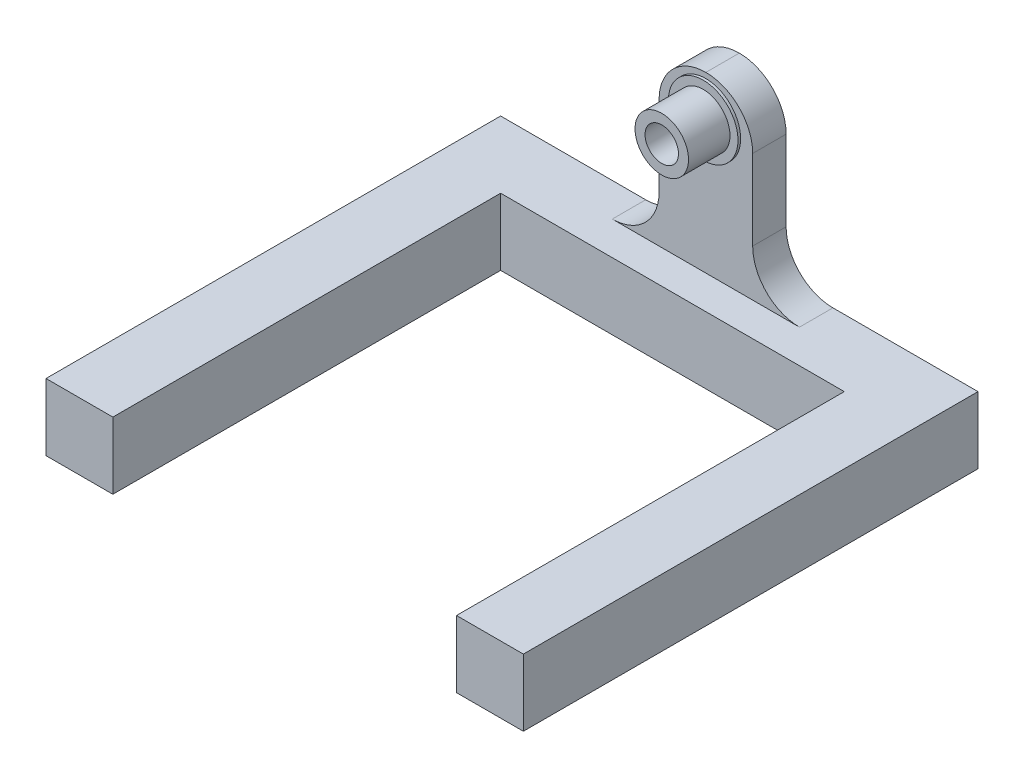
from build123d import *

# Parameters (mm, degrees)
SKETCH2_W           = 71.4
SKETCH2_H           = 93
SKETCH2_W_2         = 51.4
SKETCH2_H_2         = 73
BOSS_EXTRUDE1_DEPTH = 10
SKETCH3_W           = 14
SKETCH3_H           = 26
SKETCH3_R           = 2.5
BOSS_EXTRUDE2_DEPTH = 5
SKETCH4_R           = 4
SKETCH4_R_2         = 2.5
BOSS_EXTRUDE3_DEPTH = 6.6
SKETCH5_W           = 51.4
SKETCH5_H           = 10
CUT_EXTRUDE1_DEPTH  = 65.130647899
SKETCH6_R           = 5.2
SKETCH6_R_2         = 4
BOSS_EXTRUDE4_DEPTH = 0.4
SKETCH7_W           = 71.4
SKETCH7_H           = 25
CUT_EXTRUDE2_DEPTH  = 65.130647899
BOSS_EXTRUDE5_START = 0.4
SKETCH8_R           = 2.9
SKETCH8_R_2         = 2.5
BOSS_EXTRUDE5_DEPTH = 0.4
FILLET1_START       = -46.5
FILLET1_DEPTH       = 5
FILLET1_2_DEPTH     = 5


with BuildPart() as part:
    # Sketch2 → Boss-Extrude1 (new body)
    with BuildSketch(Plane(origin=(0, 0, 0), x_dir=(1, 0, 0), z_dir=(0, 1, 0))):
        Rectangle(SKETCH2_W, SKETCH2_H)
        Rectangle(SKETCH2_W_2, SKETCH2_H_2, mode=Mode.SUBTRACT)
    extrude(amount=BOSS_EXTRUDE1_DEPTH)

    # Sketch3 → Boss-Extrude2 (add)
    with BuildSketch(Plane(origin=(0, 0, -46.5), x_dir=(-1, 0, 0), z_dir=(0, 0, -1))):
        with Locations((0, 23)):
            Rectangle(SKETCH3_W, SKETCH3_H)
        with Locations((0, 30)):
            Circle(SKETCH3_R, mode=Mode.SUBTRACT)
    extrude(amount=-BOSS_EXTRUDE2_DEPTH)

    # Sketch4 → Boss-Extrude3 (add)
    with BuildSketch(Plane.XY.offset(-41.5)):
        with Locations(Location((0, 30, 0), (0, 0, 180))):
            Circle(SKETCH4_R)
        with Locations(Location((0, 30, 0), (0, 0, 180))):
            Circle(SKETCH4_R_2, mode=Mode.SUBTRACT)
    extrude(amount=BOSS_EXTRUDE3_DEPTH)

    # Sketch5 → Cut-Extrude1 (cut, through all)
    with BuildSketch(Plane(origin=(0, 10, 0), x_dir=(1, 0, 0), z_dir=(0, 1, 0))):
        with Locations((0, -41.5)):
            Rectangle(SKETCH5_W, SKETCH5_H)
    extrude(amount=-CUT_EXTRUDE1_DEPTH, mode=Mode.SUBTRACT)

    # Sketch6 → Boss-Extrude4 (add)
    with BuildSketch(Plane.XY.offset(-41.5)):
        with Locations(Location((0, 30, 0), (0, 0, 180))):
            Circle(SKETCH6_R)
        with Locations((0, 30)):
            Circle(SKETCH6_R_2, mode=Mode.SUBTRACT)
    extrude(amount=BOSS_EXTRUDE4_DEPTH)

    # Sketch7 → Cut-Extrude2 (cut, through all)
    with BuildSketch(Plane(origin=(0, 10, 0), x_dir=(1, 0, 0), z_dir=(0, 1, 0))):
        with Locations((0, -34)):
            Rectangle(SKETCH7_W, SKETCH7_H)
    extrude(amount=-CUT_EXTRUDE2_DEPTH, mode=Mode.SUBTRACT)

    # Sketch8 → Boss-Extrude5 (add)
    with BuildSketch(Plane(origin=(0, 0, -46.5), x_dir=(-1, 0, 0), z_dir=(0, 0, -1)).offset(BOSS_EXTRUDE5_START)):
        with Locations(Location((0, 30, 0), (0, 0, 180))):
            Circle(SKETCH8_R)
        with Locations((0, 30)):
            Circle(SKETCH8_R_2, mode=Mode.SUBTRACT)
    extrude(amount=-BOSS_EXTRUDE5_DEPTH)

    # Fillet1: read off the stored shape, not the designer's step
    # Fillet1 outline → Fillet1 (cut)
    with BuildSketch(Plane.XY.offset(FILLET1_START)):
        with BuildLine():
            ThreePointArc((0, 36), (4.949747468, 33.949747468), (7, 29))
            Line((7, 29), (7, 36))
            Line((7, 36), (0, 36))
        make_face()
        with BuildLine():
            ThreePointArc((-7, 29), (-4.949747468, 33.949747468), (0, 36))
            Line((0, 36), (-7, 36))
            Line((-7, 36), (-7, 29))
        make_face()
    extrude(amount=FILLET1_DEPTH, mode=Mode.SUBTRACT)

    # Fillet1 2 outline → Fillet1 2 (add)
    with BuildSketch(Plane.XY.offset(FILLET1_START)):
        with BuildLine():
            ThreePointArc((14, 10), (9.050252532, 12.050252532), (7, 17))
            Line((7, 17), (7, 10))
            Line((7, 10), (14, 10))
        make_face()
        with BuildLine():
            Line((-14, 10), (-7, 10))
            Line((-7, 10), (-7, 17))
            ThreePointArc((-7, 17), (-9.050252532, 12.050252532), (-14, 10))
        make_face()
    extrude(amount=FILLET1_2_DEPTH)


solid = part.part
